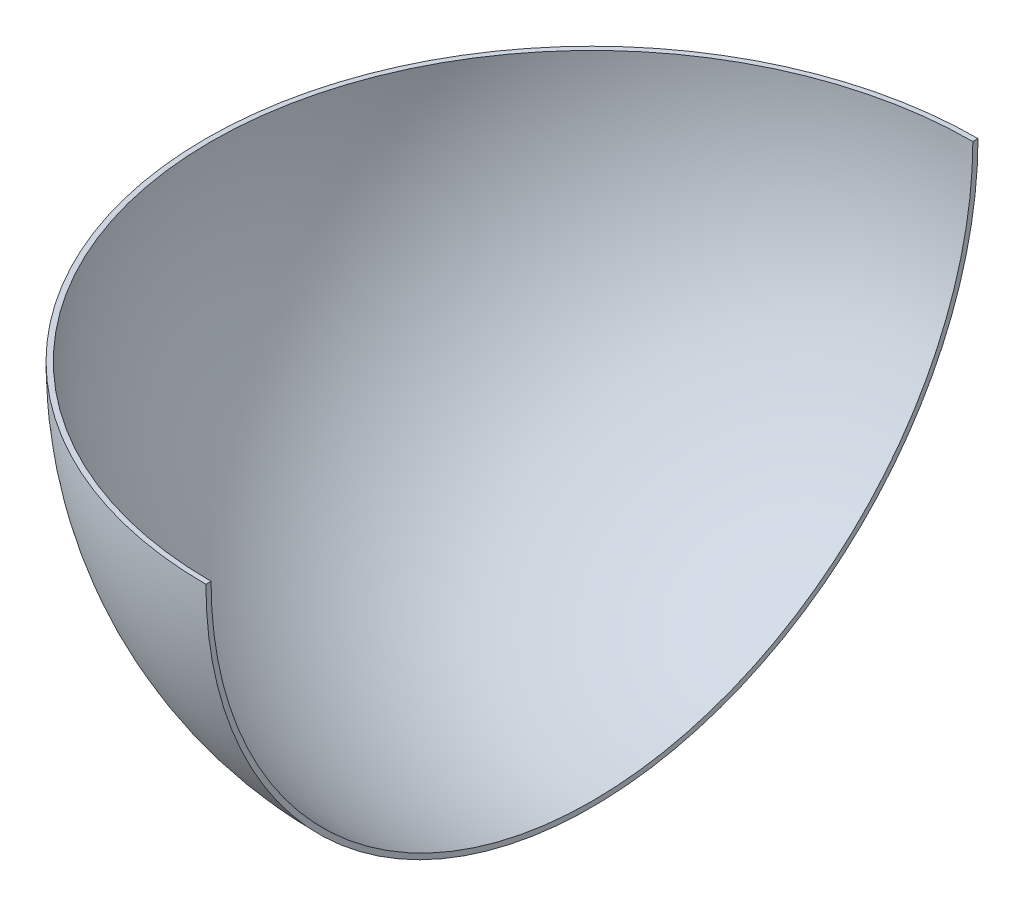
from build123d import *

# Parameters (mm, degrees)
SKETCH_3_W          = 300
SKETCH_3_H          = 150
CUT_EXTRUDE_1_DEPTH = 260.807621135


# Read off the part's stored shape, not the designer's step: 旋转1
with BuildPart() as part:
    # 旋转1 outline → 旋转1 (revolve)
    with BuildSketch(Plane.XY):
        with BuildLine():
            ThreePointArc((0, -150), (106.066017205, -106.066017151), (150, 7.5e-08))
            Line((150, 7.5e-08), (148, 1e-07))
            ThreePointArc((148, 1e-07), (104.651803651, -104.65180358), (0, -148))
            Line((0, -148), (0, -150))
        make_face()
    revolve(axis=Axis((0, 0, 0), (0, 1, 0)))

    # 草图3 → 切除-拉伸1 (cut, through all)
    with BuildSketch(Plane(origin=(0, 0, 0), x_dir=(0, 0, -1), z_dir=(1, 0, 0))):
        with Locations((0, -75)):
            Rectangle(SKETCH_3_W, SKETCH_3_H)
    extrude(amount=CUT_EXTRUDE_1_DEPTH, mode=Mode.SUBTRACT)


solid = part.part
